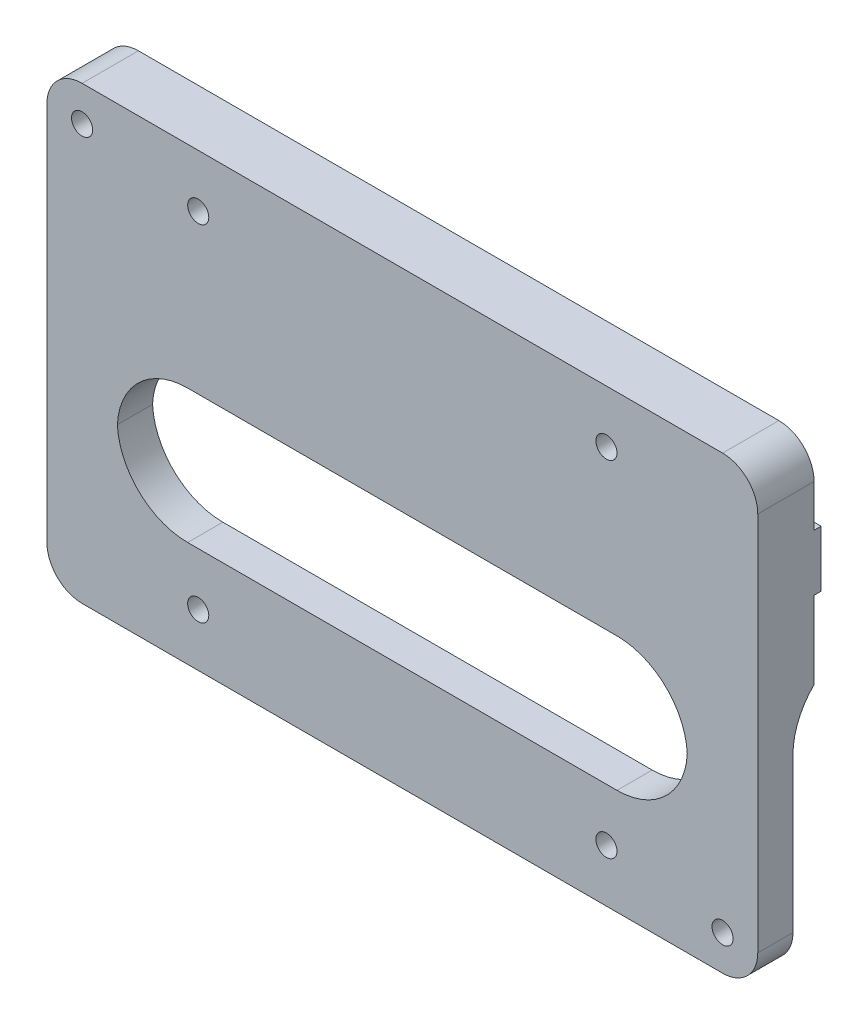
from build123d import *

# Parameters (mm, degrees)
SKETCH1_W           = 101
SKETCH1_H           = 64
SKETCH1_R           = 1.5
BOSS_EXTRUDE1_DEPTH = 8
SKETCH2_W           = 8
SKETCH2_H           = 1
BOSS_EXTRUDE2_DEPTH = 101
FILLET1_R           = 5
SKETCH3_W           = 81
SKETCH3_H           = 19
CUT_EXTRUDE1_DEPTH  = 61.317907789
FILLET2_R           = 10
SKETCH4_W           = 34
SKETCH4_H           = 3
CUT_EXTRUDE2_DEPTH  = 114.204461043
FILLET3_START       = 39.83238
FILLET3_DEPTH       = 10.66762
FILLET3_START_2     = -50.5
FILLET3_2_DEPTH     = 10.012507722
FILLET3_START_3     = -40.487492278
FILLET3_3_DEPTH     = 9.987492378
FILLET3_START_4     = 30.4999999
FILLET3_4_DEPTH     = 9.3323801
FILLET3_START_5     = -1
FILLET3_5_DEPTH     = 4


with BuildPart() as part:
    # Sketch1 → Boss-Extrude1 (new body)
    with BuildSketch(Plane.XY):
        Rectangle(SKETCH1_W, SKETCH1_H)
        with Locations((-29, 24.5)):
            Circle(SKETCH1_R, mode=Mode.SUBTRACT)
        with Locations((29, 24.5)):
            Circle(SKETCH1_R, mode=Mode.SUBTRACT)
        with Locations((29, -24.5)):
            Circle(SKETCH1_R, mode=Mode.SUBTRACT)
        with Locations((-29, -24.5)):
            Circle(SKETCH1_R, mode=Mode.SUBTRACT)
        with Locations((45.5, -27)):
            Circle(SKETCH1_R, mode=Mode.SUBTRACT)
        with Locations((-45.5, 27)):
            Circle(SKETCH1_R, mode=Mode.SUBTRACT)
    extrude(amount=BOSS_EXTRUDE1_DEPTH)

    # Sketch2 → Boss-Extrude2 (add)
    with BuildSketch(Plane(origin=(-50.5, -4.5, 0), x_dir=(0, 1, 0), z_dir=(-1, 0, 0))):
        with Locations((21.5, 0.5)):
            Rectangle(SKETCH2_W, SKETCH2_H)
    extrude(amount=-BOSS_EXTRUDE2_DEPTH)

    # Fillet1
    fillet1_edges = [part.edges().sort_by_distance(p)[0] for p in [
        (50.5, -32, 4),
        (-50.5, -32, 4),
        (-50.5, 32, 4),
        (50.5, 32, 4),
    ]]
    fillet(fillet1_edges, radius=FILLET1_R)

    # Sketch3 → Cut-Extrude1 (cut, through all)
    with BuildSketch(Plane(origin=(0, 0, 0), x_dir=(-1, 0, 0), z_dir=(0, 0, -1))):
        with Locations((0, -7.5)):
            Rectangle(SKETCH3_W, SKETCH3_H)
    extrude(amount=-CUT_EXTRUDE1_DEPTH, mode=Mode.SUBTRACT)

    # Fillet2
    # the kernel refuses this fillet: 10 mm, written as the material it adds along each edge
    with BuildSketch(Plane(origin=(40.5, -17, 0), x_dir=(-1, 0, 0), z_dir=(0, 0, 1)), Plane(origin=(-40.5, -17, 0), x_dir=(0, 1, 0), z_dir=(0, 0, 1)), Plane(origin=(40.5, 2, 0), x_dir=(0, -1, 0), z_dir=(0, 0, 1))) as fillet2_piece_1:
        with BuildLine():
            CenterArc((FILLET2_R, -FILLET2_R), FILLET2_R, 90, 90)
            Line((0, -FILLET2_R), (0, 0))
            Line((0, 0), (FILLET2_R, 0))
        make_face()
    extrude(amount=8)
    with BuildSketch(Plane(origin=(-40.5, 2, 0), x_dir=(0, -1, 0), z_dir=(0, 0, 1))) as fillet2_piece_2:
        with BuildLine():
            CenterArc((FILLET2_R, FILLET2_R), FILLET2_R, 180, 90)
            Line((0, FILLET2_R), (0, 0))
            Line((0, 0), (FILLET2_R, 0))
        make_face()
    extrude(amount=8)

    # Sketch4 → Cut-Extrude2 (cut, through all)
    with BuildSketch(Plane(origin=(50.5, -18.5, 0), x_dir=(0, 1, 0), z_dir=(-1, 0, 0))):
        with Locations((3.5, -1.5)):
            Rectangle(SKETCH4_W, SKETCH4_H)
    extrude(amount=CUT_EXTRUDE2_DEPTH, mode=Mode.SUBTRACT)

    # Fillet3: read off the stored shape, not the designer's step
    # Fillet3 outline → Fillet3 (add)
    with BuildSketch(Plane.YZ.offset(FILLET3_START)):
        with BuildLine():
            Line((2, 3), (-5.141428429, 3))
            ThreePointArc((-5.141428429, 3), (-1.268444058, 2.219544027), (2.000001555, -1.587e-06))
            Line((2.000001555, -1.587e-06), (2, 3))
        make_face()
    extrude(amount=FILLET3_DEPTH)

    # Fillet3 2 outline → Fillet3 2 (add)
    with BuildSketch(Plane.YZ.offset(FILLET3_START_2)):
        with BuildLine():
            Line((2, 3), (-5.141428429, 3))
            ThreePointArc((-5.141428429, 3), (-1.268444058, 2.219544027), (2.000001555, -1.587e-06))
            Line((2.000001555, -1.587e-06), (2, 3))
        make_face()
    extrude(amount=FILLET3_2_DEPTH)

    # Fillet3 3 outline → Fillet3 3 (add)
    with BuildSketch(Plane.YZ.offset(FILLET3_START_3)):
        with BuildLine():
            Line((2, 3), (-5.141428429, 3))
            ThreePointArc((-5.141428429, 3), (-1.268444058, 2.219544027), (2.000001555, -1.587e-06))
            Line((2.000001555, -1.587e-06), (2, 3))
        make_face()
    extrude(amount=FILLET3_3_DEPTH)

    # Fillet3 4 outline → Fillet3 4 (add)
    with BuildSketch(Plane.YZ.offset(FILLET3_START_4)):
        with BuildLine():
            Line((2, 3), (-5.141428429, 3))
            ThreePointArc((-5.141428429, 3), (-1.268444058, 2.219544027), (2.000001555, -1.587e-06))
            Line((2.000001555, -1.587e-06), (2, 3))
        make_face()
    extrude(amount=FILLET3_4_DEPTH)

    # Fillet3 5 outline → Fillet3 5 (cut)
    with BuildSketch(Plane.XY.offset(FILLET3_START_5)):
        with BuildLine():
            Line((30.4999999, -7), (40.449874371, -7))
            ThreePointArc((40.449874371, -7), (37.208203932, -0.583801513), (30.5, 2))
            Line((30.5, 2), (30.4999999, -7))
        make_face()
        with BuildLine():
            Line((-40.449874371, -7), (-30.4999999, -7))
            Line((-30.4999999, -7), (-30.5, 2))
            ThreePointArc((-30.5, 2), (-37.208203932, -0.583801513), (-40.449874371, -7))
        make_face()
    extrude(amount=FILLET3_5_DEPTH, mode=Mode.SUBTRACT)


solid = part.part
